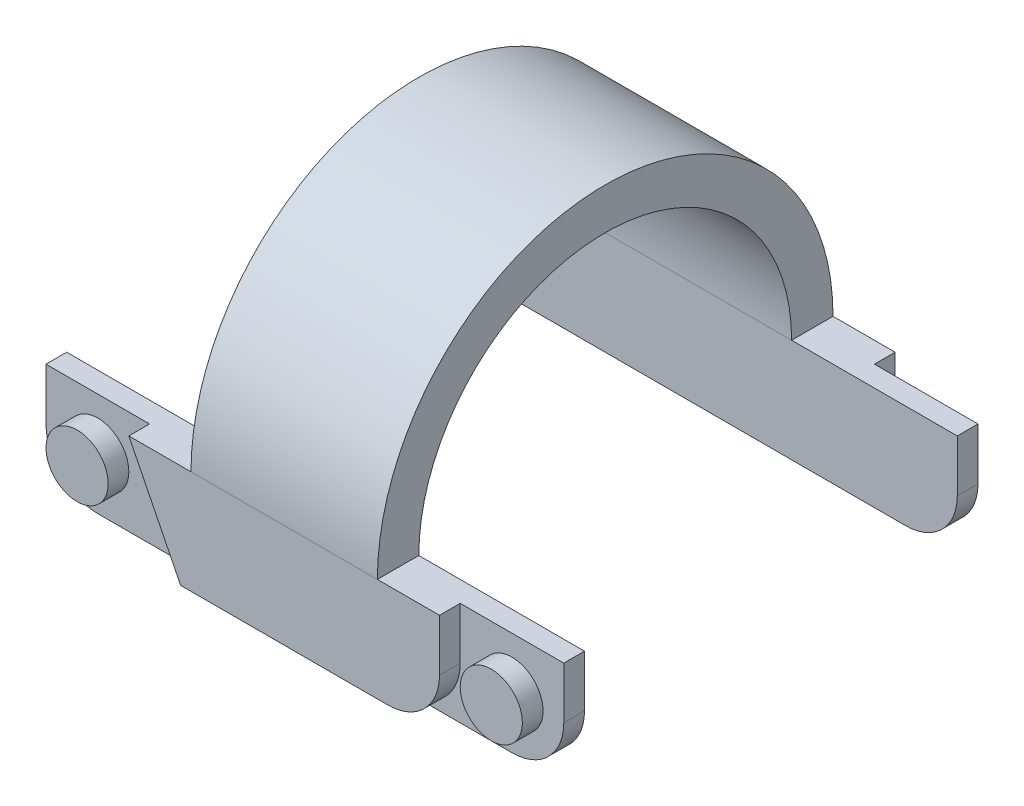
from build123d import *

# Parameters (mm, degrees)
SKETCH3_W             = 2
SKETCH3_H             = 5
BOSS_EXTRUDE1_DEPTH   = 25
BOSS_EXTRUDE1_2_DEPTH = 25
SKETCH4_W             = 5
SKETCH4_H             = 5
CUT_EXTRUDE1_DEPTH    = 1
SKETCH5_W             = 5
SKETCH5_H             = 5
CUT_EXTRUDE2_DEPTH    = 1
SWEEP1_START          = 8
SWEEP1_DEPTH          = 9
SKETCH7_R             = 1.5
BOSS_EXTRUDE2_DEPTH   = 1
BOSS_EXTRUDE3_START   = 1
SKETCH8_R             = 1.5
BOSS_EXTRUDE3_DEPTH   = 1
FILLET1_R             = 2.5
CUT_EXTRUDE3_DEPTH    = 1
CUT_EXTRUDE4_DEPTH    = 1
FILLET2_R             = 2.5


# Read off the part's stored shape, not the designer's step: Sweep1
with BuildPart() as part:
    # Sketch3 → Boss-Extrude1 (new body)
    with BuildSketch(Plane(origin=(0, 0, 0), x_dir=(0, 0, -1), z_dir=(1, 0, 0))):
        with Locations((-10, 0)):
            Rectangle(SKETCH3_W, SKETCH3_H)
    extrude(amount=BOSS_EXTRUDE1_DEPTH)

    # Sketch4 → Cut-Extrude1 (cut)
    with BuildSketch(Plane.XY.offset(11)):
        with Locations((2.5, 0)):
            Rectangle(SKETCH4_W, SKETCH4_H)
        with Locations((22.5, 0)):
            Rectangle(SKETCH4_W, SKETCH4_H)
    extrude(amount=-CUT_EXTRUDE1_DEPTH, mode=Mode.SUBTRACT)



with BuildPart() as body_2:
    # Sketch3 → Boss-Extrude1 2 (new body)
    with BuildSketch(Plane(origin=(0, 0, 0), x_dir=(0, 0, -1), z_dir=(1, 0, 0))):
        with Locations((10, 0)):
            Rectangle(SKETCH3_W, SKETCH3_H)
    extrude(amount=BOSS_EXTRUDE1_2_DEPTH)

    # Sketch5 → Cut-Extrude2 (cut)
    with BuildSketch(Plane(origin=(0, 0, -11), x_dir=(-1, 0, 0), z_dir=(0, 0, -1))):
        with Locations((-22.5, 0)):
            Rectangle(SKETCH5_W, SKETCH5_H)
        with Locations((-2.5, 0)):
            Rectangle(SKETCH5_W, SKETCH5_H)
    extrude(amount=-CUT_EXTRUDE2_DEPTH, mode=Mode.SUBTRACT)


with BuildPart() as part_1:
    add(part.part)

    add(body_2.part)  # Sweep1 merges body 2
    # Sweep1 outline → Sweep1 (add)
    with BuildSketch(Plane.YZ.offset(SWEEP1_START)):
        with BuildLine():
            Line((2.5, -9), (2.5, -11))
            ThreePointArc((2.5, -11), (13.5, 0), (2.5, 11))
            Line((2.5, 11), (2.5, 9))
            ThreePointArc((2.5, 9), (11.5, 0), (2.5, -9))
        make_face()
    extrude(amount=SWEEP1_DEPTH)

    # Sketch7 → Boss-Extrude2 (add)
    with BuildSketch(Plane(origin=(0, 0, -10), x_dir=(-1, 0, 0), z_dir=(0, 0, -1))):
        with Locations(Location((-2.5, 0, 0), (0, 0, 270))):
            Circle(SKETCH7_R)
        with Locations(Location((-22.5, 0, 0), (0, 0, 90))):
            Circle(SKETCH7_R)
    extrude(amount=BOSS_EXTRUDE2_DEPTH)

    # Sketch8 → Boss-Extrude3 (add)
    with BuildSketch(Plane.XY.offset(10).offset(BOSS_EXTRUDE3_START)):
        with Locations(Location((22.5, 0, 0), (0, 0, 90))):
            Circle(SKETCH8_R)
        with Locations(Location((2.5, 0, 0), (0, 0, 270))):
            Circle(SKETCH8_R)
    extrude(amount=-BOSS_EXTRUDE3_DEPTH)

    # Fillet1
    fillet1_edges = [part_1.edges().sort_by_distance(p)[0] for p in [
        (0, -2.5, 9.5),
        (25, -2.5, 9.5),
        (25, -2.5, -9.5),
        (0, -2.5, -9.5),
    ]]
    fillet(fillet1_edges, radius=FILLET1_R)

    # Sketch9 → Cut-Extrude3 (cut)
    with BuildSketch(Plane.XY.offset(11)):
        Polygon((5, 2.5), (7.5, -2.5), (5, -2.5), align=None)
    extrude(amount=-CUT_EXTRUDE3_DEPTH, mode=Mode.SUBTRACT)

    # Sketch10 → Cut-Extrude4 (cut)
    with BuildSketch(Plane(origin=(0, 0, -11), x_dir=(-1, 0, 0), z_dir=(0, 0, -1))):
        Polygon((-5, 2.5), (-7.5, -2.5), (-5, -2.5), align=None)
    extrude(amount=-CUT_EXTRUDE4_DEPTH, mode=Mode.SUBTRACT)

    # Fillet2
    fillet2_edges = [part_1.edges().sort_by_distance(p)[0] for p in [
        (20, -2.5, 10.5),
        (20, -2.5, -10.5),
    ]]
    fillet(fillet2_edges, radius=FILLET2_R)


solid = part_1.part
